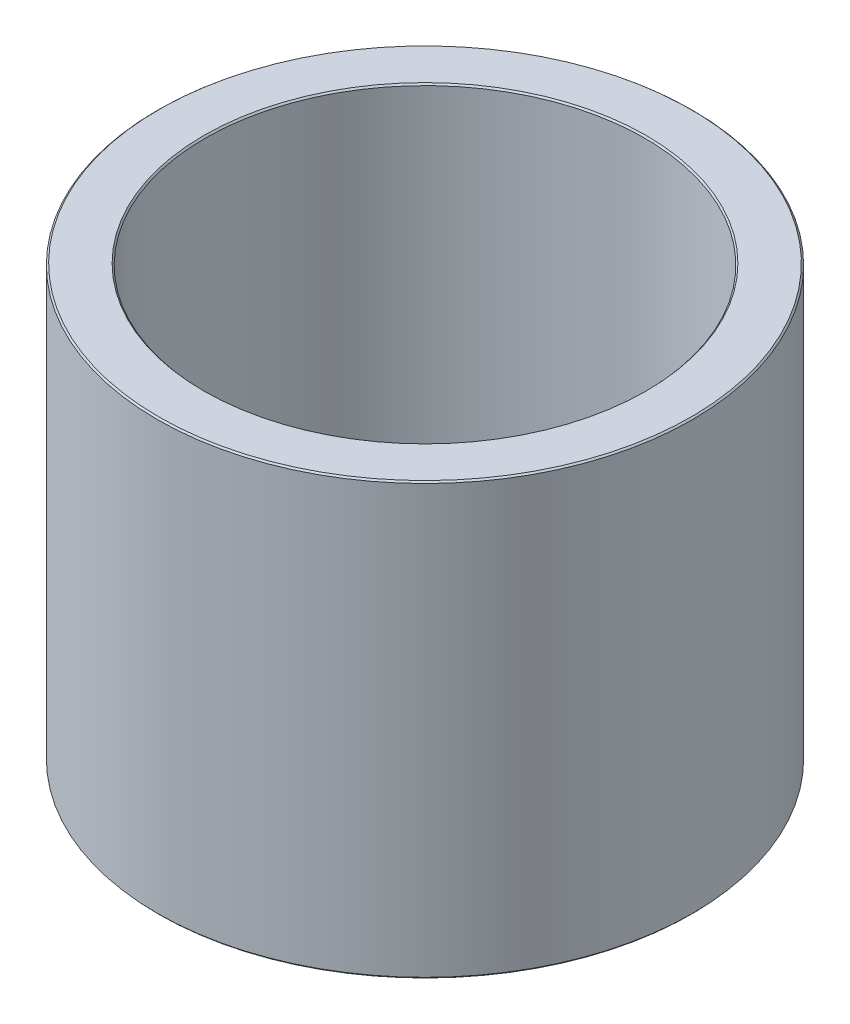
from build123d import *
from OCP.BRepFilletAPI import BRepFilletAPI_MakeChamfer

# Parameters (mm, degrees)
SKETCH1_R           = 47.5
BOSS_EXTRUDE1_DEPTH = 76.407010138
SKETCH2_R           = 38.99670127
CUT_EXTRUDE1_DEPTH  = 102.73756041
CHAMFER1_SIZE       = 0.255831651
CHAMFER1_SIZE2      = 0.280808559


with BuildPart() as part:
    # Sketch1 → Boss-Extrude1 (new body)
    with BuildSketch(Plane(origin=(0, 0, 0), x_dir=(1, 0, 0), z_dir=(0, 1, 0))):
        Circle(SKETCH1_R)
    extrude(amount=BOSS_EXTRUDE1_DEPTH)

    # Sketch2 → Cut-Extrude1 (cut, through all)
    with BuildSketch(Plane(origin=(0, 0, 0), x_dir=(1, 0, 0), z_dir=(0, 1, 0))):
        Circle(SKETCH2_R)
    extrude(amount=CUT_EXTRUDE1_DEPTH, mode=Mode.SUBTRACT)

    # Chamfer1: one chamfer whose edges measure the first distance from different faces: ONE call of the kernel's chamfer builder (chamfer() names one face for all edges)
    chamfer1_edges_1 = [part.edges().sort_by_distance(p)[0] for p in [
        (-38.99670127, 76.407010138, 0),
    ]]
    chamfer1_side_1 = [part.faces().sort_by_distance(p)[0] for p in [
        (-46.156497116, 76.407010138, 0),
    ]]
    chamfer1_edges_2 = [part.edges().sort_by_distance(p)[0] for p in [
        (-38.99670127, 0, 0),
    ]]
    chamfer1_side_2 = [part.faces().sort_by_distance(p)[0] for p in [
        (-38.99670127, 38.203505069, 0),
    ]]
    chamfer1_edges_3 = [part.edges().sort_by_distance(p)[0] for p in [
        (-47.5, 0, 0),
    ]]
    chamfer1_side_3 = [part.faces().sort_by_distance(p)[0] for p in [
        (-46.156497116, 0, 0),
    ]]
    chamfer1_edges_4 = [part.edges().sort_by_distance(p)[0] for p in [
        (-47.5, 76.407010138, 0),
    ]]
    chamfer1_side_4 = [part.faces().sort_by_distance(p)[0] for p in [
        (-47.5, 38.203505069, 0),
    ]]
    chamfer1 = BRepFilletAPI_MakeChamfer(part.part.solid().wrapped)
    for e in chamfer1_edges_1:
        chamfer1.Add(CHAMFER1_SIZE, CHAMFER1_SIZE2, e.wrapped, chamfer1_side_1[0].wrapped)  # the first distance lies on this face
    for e in chamfer1_edges_2:
        chamfer1.Add(CHAMFER1_SIZE, CHAMFER1_SIZE2, e.wrapped, chamfer1_side_2[0].wrapped)  # the first distance lies on this face
    for e in chamfer1_edges_3:
        chamfer1.Add(CHAMFER1_SIZE, CHAMFER1_SIZE2, e.wrapped, chamfer1_side_3[0].wrapped)  # the first distance lies on this face
    for e in chamfer1_edges_4:
        chamfer1.Add(CHAMFER1_SIZE, CHAMFER1_SIZE2, e.wrapped, chamfer1_side_4[0].wrapped)  # the first distance lies on this face
    add(Compound.cast(chamfer1.Shape()), mode=Mode.REPLACE)


solid = part.part
